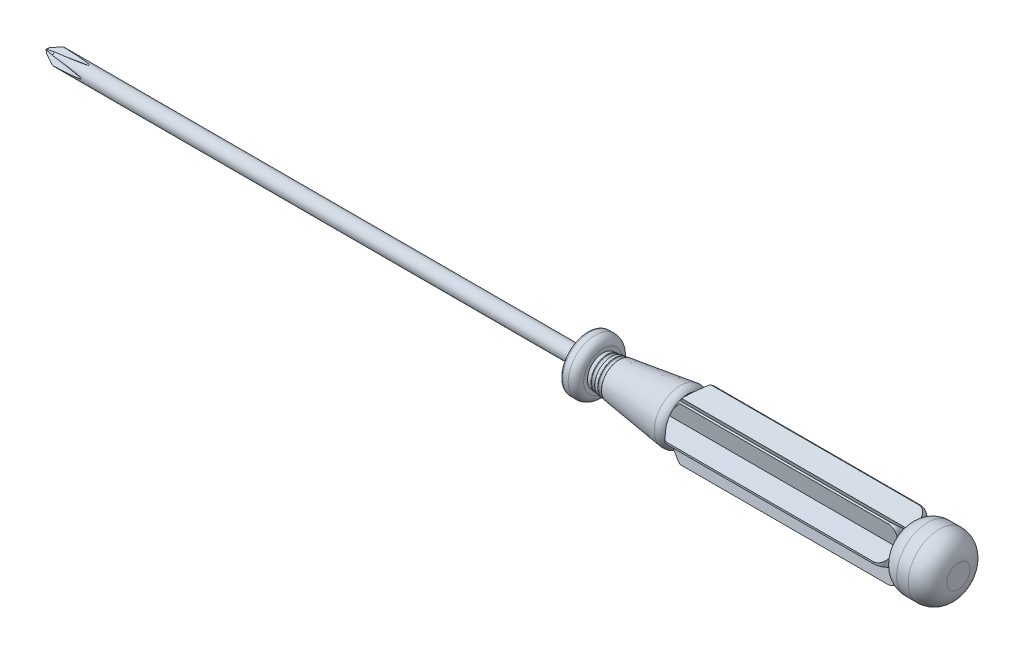
from build123d import *

# Parameters (mm, degrees)
FILLET_1_R               = 1
SKETCH_2_R               = 0.25000000000000083
FILLET_4_R               = 1
FILLET_5_R               = 0.3
FILLET_6_R               = 1
FILLET_7_R               = 0.6
FILLET_8_R               = 2.5
FILLET_9_R               = 2.5
FILLET_12_R              = 0.05
CUT_EXTRUDE_2_REACH      = 44.379
PATTERN_CIRCULAR_3_COUNT = 6
PATTERN_CIRCULAR_4_COUNT = 4


with BuildPart() as part:
    # 草图1 → 旋转1 (revolve)
    with BuildSketch(Plane(origin=(0, 0, 0), x_dir=(1, 0, 0), z_dir=(0, 1, 0)), mode=Mode.PRIVATE) as revolve_1_sk:
        Polygon((0, 0), (42, 0), (42, 4), (14.000000000000002, 3.9999999999999964), (12.999999999999998, 2.899999999999997), (13, 3.4999999999999964), (2, 1.999999999999995), (2.0000000000000004, 3.4999999999999996), (4.3e-16, 3.5), align=None)
    revolve(revolve_1_sk.sketch.rotate(Axis((0, 0, 0), (1, 0, 0)), 180), axis=Axis((0, 0, 0), (1, 0, 0)))

    # 圆角1
    fillet_1_edges = [part.edges().sort_by_distance(p)[0] for p in [
        (42, -9.8e-16, -4),
    ]]
    fillet(fillet_1_edges, radius=FILLET_1_R)

    # 草图2 → 切除-旋转2 (revolve, cut)
    with BuildSketch(Plane(origin=(0, 0, 0), x_dir=(1, 0, 0), z_dir=(0, 1, 0))):
        with Locations((2.8, 2.109090909090903)):
            Circle(SKETCH_2_R)
        with Locations((3.8, 2.24545454545454)):
            Circle(SKETCH_2_R)
    revolve(axis=Axis((13, 0, 0), (1, 0, 0)), mode=Mode.SUBTRACT)

    # 圆角4
    fillet_4_edges = [part.edges().sort_by_distance(p)[0] for p in [
        (2.0000000000000004, -8.6e-16, -3.4999999999999996),
    ]]
    fillet(fillet_4_edges, radius=FILLET_4_R)

    # 圆角5
    fillet_5_edges = [part.edges().sort_by_distance(p)[0] for p in [
        (4.3e-16, -8.6e-16, -3.5),
    ]]
    fillet(fillet_5_edges, radius=FILLET_5_R)

    # 草图4 → 旋转5 (revolve)
    with BuildSketch(Plane(origin=(0, 0, 0), x_dir=(1, 0, 0), z_dir=(0, 1, 0))):
        Polygon((42, -1.49e-15), (42, 3.999999999999999), (48.00000000000001, 4), (48, -3.9e-16), align=None)
    revolve(axis=Axis((0, 0, 0), (-1, 0, 0)))

    # 圆角6
    # the kernel refuses this fillet: 1 mm, written as the material it takes off along each edge
    with BuildSketch(Plane(origin=(13, 0, 0), x_dir=(0, 1.2e-16, 1), z_dir=(0, 1, -1.2e-16))) as fillet_6_piece_1:
        with BuildLine():
            CenterArc((2.374710288066199, -0.8509234504563388), FILLET_6_R, 352.2348339815747, 66.07741745289559)
            Line((3.365540456110498, -0.9860366551896522), (3.4999999999999964, 0))
            Line((3.4999999999999964, 0), (2.899999999999994, -5.33e-15))
        make_face()
    revolve(axis=Axis((13, 0, 0), (1, 0, 0)), mode=Mode.SUBTRACT)

    # 圆角7
    fillet_7_edges = [part.edges().sort_by_distance(p)[0] for p in [
        (14.000000000000002, -9.8e-16, -3.9999999999999964),
    ]]
    fillet(fillet_7_edges, radius=FILLET_7_R)

    # 圆角8
    fillet_8_edges = [part.edges().sort_by_distance(p)[0] for p in [
        (48.00000000000001, -4.9e-16, 4),
    ]]
    fillet(fillet_8_edges, radius=FILLET_8_R)

    # 圆角9
    # the kernel refuses this fillet: 2.5 mm, written as the material it takes off along each edge
    with BuildSketch(Plane(origin=(42, 0, 0), x_dir=(0, 0, -1), z_dir=(0, 1, 0))) as fillet_9_piece_1:
        with BuildLine():
            CenterArc((1.4999999999999991, -2), FILLET_9_R, 0, 53.13010235415597)
            Line((2.9999999999999996, 0), (3.999999999999999, 0))
            Line((3.999999999999999, 0), (3.999999999999999, -2))
        make_face()
    revolve(axis=Axis((42, 0, 0), (-1, 0, 0)), mode=Mode.SUBTRACT)

    # 圆角12
    # the kernel refuses this fillet: 0.05 mm, written as the material it takes off along each edge
    with BuildSketch(Plane(origin=(3.0477075420110764, 0, 0), x_dir=(0, 0, -1), z_dir=(0, 1, 0))) as fillet_12_piece_1:
        with BuildLine():
            CenterArc((2.0995164256363172, -0.05213963450819481), FILLET_12_R, 7.765166018425516, 80.40593177313951)
            ThreePointArc((2.1011121728787483, -0.00216510508831647), (2.1220360359031956, -0.00195708041632026), (2.142869210274233, 0))
            Line((2.142869210274233, 0), (2.1490579340385323, -0.04538397427152896))
        make_face()
    revolve(axis=Axis((3.0477075420110764, 0, 0), (-1, 0, 0)), revolution_arc=180, mode=Mode.SUBTRACT)
    with BuildSketch(Plane(origin=(2.552292457988925, 0, 0), x_dir=(0, 0, -1), z_dir=(0, 1, 0))) as fillet_12_piece_2:
        with BuildLine():
            CenterArc((2.0195823757410607, 0.03862831403486311), FILLET_12_R, 287.35923424528585, 80.40593177313967)
            Line((2.0691238841432757, 0.04538397427152896), (2.075312607907576, 0))
            ThreePointArc((2.075312607907576, 0), (2.054716071515695, -0.00369242559680494), (2.034500464632701, -0.0090943286394598))
        make_face()
    revolve(axis=Axis((2.552292457988925, 0, 0), (-1, 0, 0)), revolution_arc=180, mode=Mode.SUBTRACT)
    with BuildSketch(Plane(origin=(4.047707542011076, 0, 0), x_dir=(0, 0, -1), z_dir=(0, 1, 0))) as fillet_12_piece_3:
        with BuildLine():
            CenterArc((2.2358800619999535, -0.05213963450819481), FILLET_12_R, 7.765166018425012, 80.40593177314054)
            ThreePointArc((2.237475809242384, -0.00216510508831647), (2.258399672266832, -0.0019570804163207), (2.2792328466378695, 0))
            Line((2.2792328466378695, 0), (2.2854215704021685, -0.0453839742715294))
        make_face()
    revolve(axis=Axis((4.047707542011076, 0, 0), (-1, 0, 0)), revolution_arc=180, mode=Mode.SUBTRACT)
    with BuildSketch(Plane(origin=(3.552292457988925, 0, 0), x_dir=(0, 0, -1), z_dir=(0, 1, 0))) as fillet_12_piece_4:
        with BuildLine():
            CenterArc((2.1559460121046983, 0.03862831403486311), FILLET_12_R, 287.3592342452854, 80.40593177314015)
            Line((2.2054875205069133, 0.04538397427152896), (2.211676244271213, 0))
            ThreePointArc((2.211676244271213, 0), (2.1910797078793323, -0.00369242559680494), (2.1708641009963383, -0.0090943286394598))
        make_face()
    revolve(axis=Axis((3.552292457988925, 0, 0), (-1, 0, 0)), revolution_arc=180, mode=Mode.SUBTRACT)
    with BuildSketch(Plane(origin=(3.552292457988925, 0, 0), x_dir=(0, -1.2e-16, 1), z_dir=(0, -1, -1.2e-16))) as fillet_12_piece_5:
        with BuildLine():
            CenterArc((2.1559460121046983, 0.03862831403486311), FILLET_12_R, 287.3592342452854, 80.40593177314015)
            Line((2.2054875205069133, 0.04538397427152896), (2.211676244271213, 0))
            ThreePointArc((2.211676244271213, 0), (2.1910797078793323, -0.00369242559680494), (2.1708641009963383, -0.0090943286394598))
        make_face()
    revolve(axis=Axis((3.552292457988925, 0, 0), (-1, 0, 0)), revolution_arc=180, mode=Mode.SUBTRACT)
    with BuildSketch(Plane(origin=(4.047707542011076, 0, 0), x_dir=(0, -1.2e-16, 1), z_dir=(0, -1, -1.2e-16))) as fillet_12_piece_6:
        with BuildLine():
            CenterArc((2.2358800619999535, -0.05213963450819481), FILLET_12_R, 7.765166018425012, 80.40593177314054)
            ThreePointArc((2.237475809242384, -0.00216510508831647), (2.258399672266832, -0.0019570804163207), (2.2792328466378695, 0))
            Line((2.2792328466378695, 0), (2.2854215704021685, -0.0453839742715294))
        make_face()
    revolve(axis=Axis((4.047707542011076, 0, 0), (-1, 0, 0)), revolution_arc=180, mode=Mode.SUBTRACT)
    with BuildSketch(Plane(origin=(2.552292457988925, 0, 0), x_dir=(0, -1.2e-16, 1), z_dir=(0, -1, -1.2e-16))) as fillet_12_piece_7:
        with BuildLine():
            CenterArc((2.0195823757410607, 0.03862831403486311), FILLET_12_R, 287.35923424528585, 80.40593177313967)
            Line((2.0691238841432757, 0.04538397427152896), (2.075312607907576, 0))
            ThreePointArc((2.075312607907576, 0), (2.054716071515695, -0.00369242559680494), (2.034500464632701, -0.0090943286394598))
        make_face()
    revolve(axis=Axis((2.552292457988925, 0, 0), (-1, 0, 0)), revolution_arc=180, mode=Mode.SUBTRACT)
    with BuildSketch(Plane(origin=(3.0477075420110764, 0, 0), x_dir=(0, -1.2e-16, 1), z_dir=(0, -1, -1.2e-16))) as fillet_12_piece_8:
        with BuildLine():
            CenterArc((2.0995164256363172, -0.05213963450819481), FILLET_12_R, 7.765166018425516, 80.40593177313951)
            ThreePointArc((2.1011121728787483, -0.00216510508831647), (2.1220360359031956, -0.00195708041632026), (2.142869210274233, 0))
            Line((2.142869210274233, 0), (2.1490579340385323, -0.04538397427152896))
        make_face()
    revolve(axis=Axis((3.0477075420110764, 0, 0), (-1, 0, 0)), revolution_arc=180, mode=Mode.SUBTRACT)

    # 切除-拉伸2: up to this cone (the profile starts inside it)
    cut_extrude_2_end = Plane(origin=(42, 0, 0), z_dir=(1, 0, 0)).offset(-31.636362636363646) * Cone(1.10000000575e-06, 122.44689999999932, 111.3153626363635, align=(Align.CENTER, Align.CENTER, Align.MIN), mode=Mode.PRIVATE)
    # 草图10 → 切除-拉伸2 (cut, up to the surface)
    with BuildSketch(Plane(origin=(41.99999999999999, 0, 0), x_dir=(0, 0, -1), z_dir=(1, 0, 0)), mode=Mode.PRIVATE) as cut_extrude_2_sk1:
        Polygon((0, 2), (-3.1224989991991987, 4.500000000000001), (3.1224989991991987, 4.500000000000001), align=None)
    cut_extrude_2_tool1 = extrude(cut_extrude_2_sk1.sketch, amount=-CUT_EXTRUDE_2_REACH, mode=Mode.PRIVATE) & cut_extrude_2_end
    cut_extrude_2 = cut_extrude_2_tool1.solids().sort_by_distance((42, 3.666667, 0))[0]
    add(cut_extrude_2, mode=Mode.SUBTRACT)

    # 阵列(圆周)3: 切除-拉伸2 ×6 about axis
    pattern_circular_3_axis = Axis((0, -5e-17, -7e-17), (1, 0, 0))
    for i in range(1, PATTERN_CIRCULAR_3_COUNT):
        add(cut_extrude_2.rotate(pattern_circular_3_axis, i * 360 / PATTERN_CIRCULAR_3_COUNT), mode=Mode.SUBTRACT)

    # 草图11 → 旋转6 (revolve)
    with BuildSketch(Plane(origin=(0, 0, 0), x_dir=(1, 0, 0), z_dir=(0, 1, 0)), mode=Mode.PRIVATE) as revolve_6_sk:
        Polygon((0, 0), (-70, 0), (-70, 0.2), (-68.4, 1), (2.2e-16, 1), align=None)
    revolve(revolve_6_sk.sketch.rotate(Axis((0, 0, 0), (-1, 0, 0)), 348.745617034), axis=Axis((0, 0, 0), (-1, 0, 0)))

    # 边界-切除3: read off the stored shape, not the designer's step
    # 边界-切除3: loft between two sections, ruled curve by curve
    other_3_from = [
        Edge.make_bspline([(-70, 1.733600667, 1.5), (-70, 1.599847072, 1.387767407), (-70, 1.331598354, 1.162680007), (-70, 0.928665825, 0.824579471), (-70, 0.526864774, 0.487428357), (-70, 0.260848121, 0.264213881), (-70, 0.104810481, 0.133282755), (-70, 0.069066267, 0.084654914), (-70, 0.0511381, -2.76e-05), (-70, 0.069070492, -0.084647301), (-70, 0.104810481, -0.133282755), (-70, 0.260848121, -0.264213881), (-70, 0.526864774, -0.487428357), (-70, 0.928665825, -0.824579471), (-70, 1.331598354, -1.162680007), (-70, 1.599847072, -1.387767407), (-70, 1.733600667, -1.5)], [0, 0, 0, 0, 0.114704858088107, 0.229409716176214, 0.344114574264322, 0.458819432352429, 0.458819432352429, 0.479409716176214, 0.5, 0.520590283823785, 0.541180567647571, 0.541180567647571, 0.655885425735678, 0.770590283823785, 0.885295141911893, 1, 1, 1, 1], 3),
        Edge.make_line((-70, 1.733600667, -1.5), (-70, 1.733600667, 1.5)),
    ]
    other_3_to = [
        Edge.make_bspline([(-64.5, 2.05, 1.586727747), (-64.5, 1.966666667, 1.467715413), (-64.5, 1.800500766, 1.230405913), (-64.5, 1.551625074, 0.874974589), (-64.5, 1.302012073, 0.51849028), (-64.5, 1.134347977, 0.279041135), (-64.5, 1.034858978, 0.13695612), (-64.5, 1.009469836, 0.087353503), (-64.5, 0.995236304, 0), (-64.5, 1.009469836, -0.087353503), (-64.5, 1.034858978, -0.13695612), (-64.5, 1.134347977, -0.279041135), (-64.5, 1.302012073, -0.51849028), (-64.5, 1.551625074, -0.874974589), (-64.5, 1.800500766, -1.230405913), (-64.5, 1.966666667, -1.467715413), (-64.5, 2.05, -1.586727747)], [0, 0, 0, 0, 0.114704858088107, 0.229409716176214, 0.344114574264322, 0.458819432352429, 0.458819432352429, 0.479409716176214, 0.5, 0.520590283823785, 0.541180567647571, 0.541180567647571, 0.655885425735678, 0.770590283823785, 0.885295141911893, 1, 1, 1, 1], 3),
        Edge.make_line((-64.5, 2.05, -1.586727747), (-64.5, 2.05, 1.586727747)),
    ]
    other_3 = Solid(Shell([*[Face.make_surface_from_curves(other_3_from[k], other_3_to[k]) for k in range(2)], Face(Wire(other_3_from)), Face(Wire(other_3_to))]))
    add(other_3, mode=Mode.SUBTRACT)

    # 阵列(圆周)4: 边界-切除3 ×4 about axis
    pattern_circular_4_axis = Axis((0, 0, 0), (1, 0, 0))
    for i in range(1, PATTERN_CIRCULAR_4_COUNT):
        add(other_3.rotate(pattern_circular_4_axis, i * 360 / PATTERN_CIRCULAR_4_COUNT), mode=Mode.SUBTRACT)


solid = part.part
